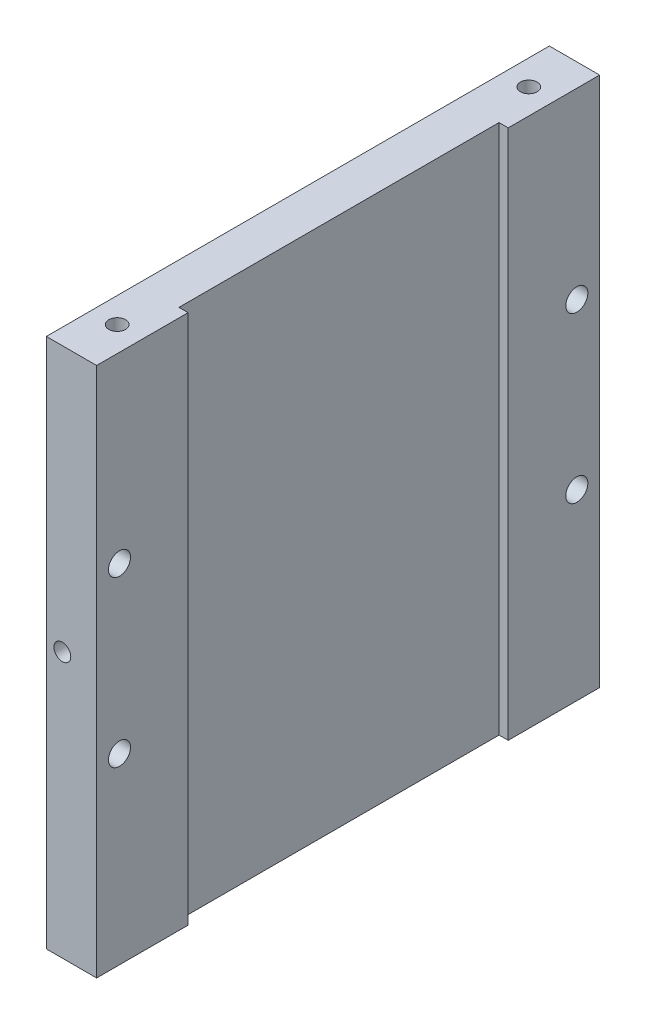
from build123d import *

# Parameters (mm, degrees)
SKETCH2_W              = 11
SKETCH2_H              = 116
BOSS_EXTRUDE2_DEPTH    = 109.999999964
SKETCH3_W              = 2
SKETCH3_H              = 70
CUT_EXTRUDE1_DEPTH     = 129.848748531
CUT_EXTRUDE2_DEPTH     = 7
CUT_EXTRUDE2_DRAFT     = -45
CUT_EXTRUDE3_START     = -109.999999964
CUT_EXTRUDE3_OUTLINE_R = 1.8415
CUT_EXTRUDE3_DEPTH     = 109.999999964
SKETCH7_R              = 1.8415
CUT_EXTRUDE4_DEPTH     = 25.4
CUT_EXTRUDE5_START     = -25.4
SKETCH8_R              = 1.8415
CUT_EXTRUDE5_DEPTH     = 25.4
SKETCH9_R              = 2.413
CUT_EXTRUDE6_DEPTH     = 81.684571085


# Read off the part's stored shape, not the designer's step: Cut-Extrude3
with BuildPart() as part:
    # Sketch2 → Boss-Extrude2 (new body)
    with BuildSketch(Plane.XY.offset(54.999999982)):
        with Locations((-5.5, 0)):
            Rectangle(SKETCH2_W, SKETCH2_H)
    extrude(amount=-BOSS_EXTRUDE2_DEPTH)

    # Sketch3 → Cut-Extrude1 (cut, through all)
    with BuildSketch(Plane(origin=(0, 58, 0), x_dir=(1, 0, 0), z_dir=(0, 1, 0))):
        with Locations((-1, 1.8e-08)):
            Rectangle(SKETCH3_W, SKETCH3_H)
    extrude(amount=-CUT_EXTRUDE1_DEPTH, mode=Mode.SUBTRACT)


with BuildPart() as cut_extrude2_tool:
    # Sketch5 → Cut-Extrude2 (with draft: the straight prism first)
    with BuildSketch(Plane.ZY.offset(11)):
        with BuildLine():
            Line((-44.45, 0), (-44.45, -77.05))
            Line((-44.45, -77.05), (44.45, -77.05))
            Line((44.45, -77.05), (44.45, 0))
            ThreePointArc((44.45, 0), (0, 44.45), (-44.45, 0))
        make_face()
    extrude(amount=-CUT_EXTRUDE2_DEPTH)
    # Cut-Extrude2: the draft: its side faces are tilted about the plane it starts from
    cut_extrude2_sides = [cut_extrude2_tool.faces().sort_by_distance(p)[0] for p in [
        (-7.5, -38.525, -44.45),
        (-7.5, -77.05, 0),
        (-7.5, -38.525, 44.45),
        (-7.5, 44.45, 0),
    ]]
    draft(cut_extrude2_sides, Plane.ZY.offset(11), CUT_EXTRUDE2_DRAFT)


with BuildPart() as part_1:
    add(part.part)

    # Cut-Extrude2: cut by cut_extrude2_tool
    add(cut_extrude2_tool.part, mode=Mode.SUBTRACT)

    # Cut-Extrude3 outline → Cut-Extrude3 (cut)
    with BuildSketch(Plane.XY.offset(54.999999982).offset(CUT_EXTRUDE3_START)):
        with Locations((-7.5, 0)):
            Circle(CUT_EXTRUDE3_OUTLINE_R)
    extrude(amount=CUT_EXTRUDE3_DEPTH, mode=Mode.SUBTRACT)

    # Sketch7 → Cut-Extrude4 (cut)
    with BuildSketch(Plane(origin=(0, 58, 0), x_dir=(1, 0, 0), z_dir=(0, 1, 0))):
        with Locations(Location((-5.5, -44.999999982, 0), (0, 0, 270))):
            Circle(SKETCH7_R)
        with Locations(Location((-5.5, 44.999999982, 0), (0, 0, 270))):
            Circle(SKETCH7_R)
    extrude(amount=-CUT_EXTRUDE4_DEPTH, mode=Mode.SUBTRACT)

    # Sketch8 → Cut-Extrude5 (cut)
    with BuildSketch(Plane.XZ.offset(58).offset(CUT_EXTRUDE5_START)):
        with Locations(Location((-5.5, 44.999999982, 0), (0, 0, 90))):
            Circle(SKETCH8_R)
        with Locations(Location((-5.5, -44.999999982, 0), (0, 0, 90))):
            Circle(SKETCH8_R)
    extrude(amount=CUT_EXTRUDE5_DEPTH, mode=Mode.SUBTRACT)

    # Sketch9 → Cut-Extrude6 (cut, through all)
    with BuildSketch(Plane(origin=(0, 0, 0), x_dir=(0, 0, -1), z_dir=(1, 0, 0))):
        with Locations(Location((-49.999999982, 18, 0), (0, 0, 90))):
            Circle(SKETCH9_R)
        with Locations(Location((-49.999999982, -18, 0), (0, 0, 90))):
            Circle(SKETCH9_R)
        with Locations(Location((49.999999982, -18, 0), (0, 0, 90))):
            Circle(SKETCH9_R)
        with Locations(Location((49.999999982, 18, 0), (0, 0, 90))):
            Circle(SKETCH9_R)
    extrude(amount=-CUT_EXTRUDE6_DEPTH, mode=Mode.SUBTRACT)


solid = part_1.part
